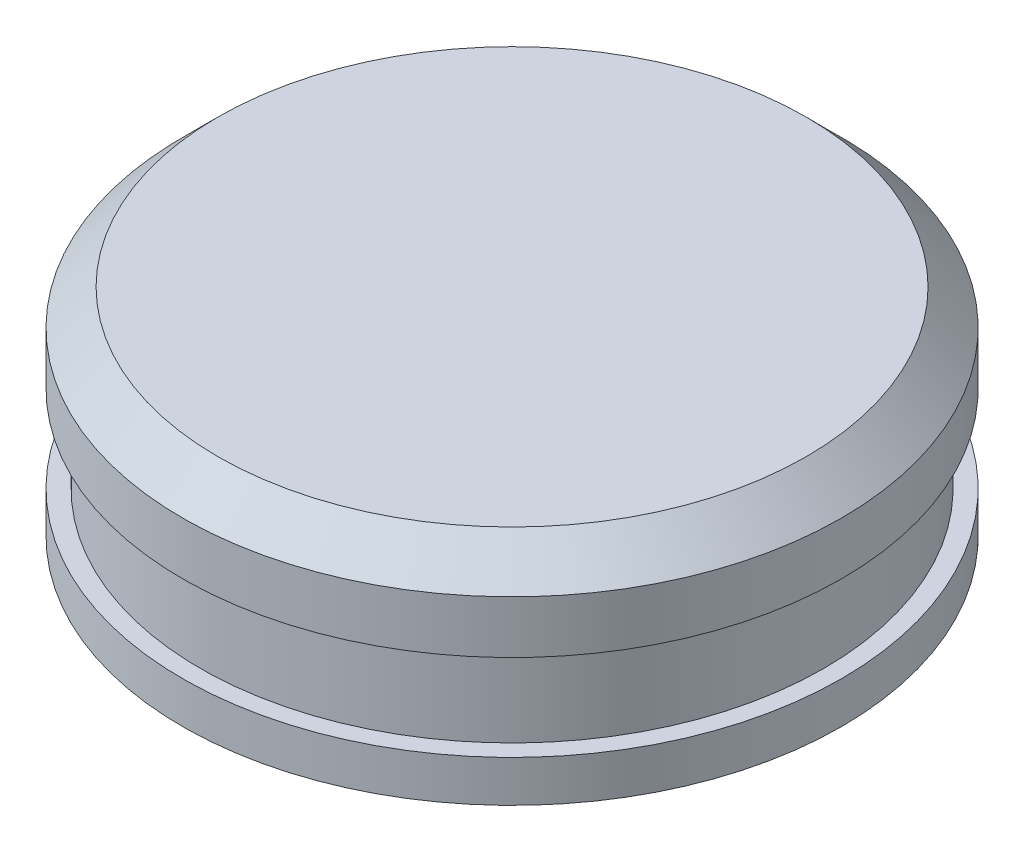
from build123d import *


with BuildPart() as part:
    # Sketch1 → body (revolve)
    with BuildSketch(Plane.XY):
        Polygon((0, 15), (44.438966023, 15), (44.438966023, 0), (53, 0), (53, 6.68101305), (50.153076737, 6.68101305), (50.153076737, 20.590266707), (53, 20.590266707), (53, 29.049695832), (47.306153474, 34.743542359), (0, 34.743542359), align=None)
    revolve(axis=Axis((0, 0, 0), (0, 1, 0)))


solid = part.part
